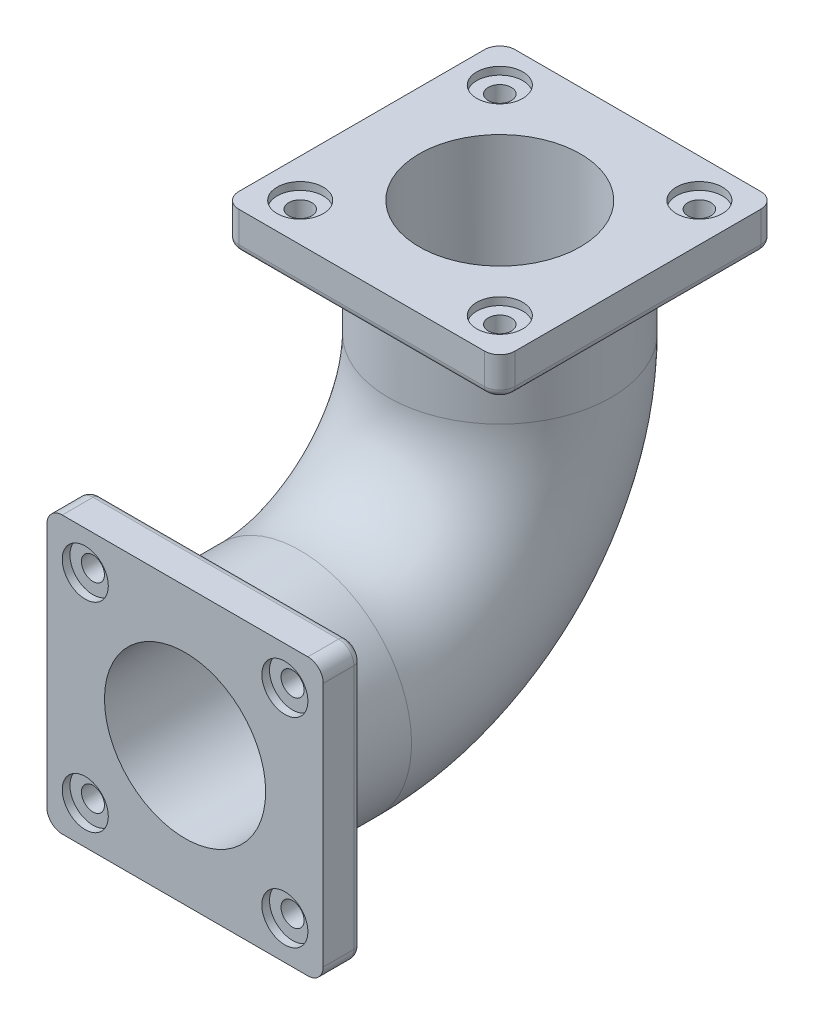
from build123d import *
from build123d.topology import SkipClean

# Parameters (mm, degrees)
IZIM3_R                     = 105
IZIM3_R_2                   = 15
Y_KSEKLIK_EKSTR_ZYON1_DEPTH = 50
IZIM4_R                     = 30
KES_EKSTR_ZYON1_DEPTH       = 10
IZIM5_R                     = 145
IZIM5_R_2                   = 105
EKSTR_ZYON_NCE1_DEPTH       = 100
IZIM95_R                    = 145
IZIM95_R_2                  = 105
RADYUS1_R                   = 10
RADYUS2_R                   = 10


with BuildPart() as part:
    # Çizim3 → Yükseklik-Ekstrüzyon1 (new body)
    with BuildSketch(Plane.XY):
        with BuildLine():
            Line((-160, -180), (160, -180))
            ThreePointArc((160, -180), (174.142135624, -174.142135624), (180, -160))
            Line((180, -160), (180, 160))
            ThreePointArc((180, 160), (174.142135624, 174.142135624), (160, 180))
            Line((160, 180), (-160, 180))
            ThreePointArc((-160, 180), (-174.142135624, 174.142135624), (-180, 160))
            Line((-180, 160), (-180, -160))
            ThreePointArc((-180, -160), (-174.142135624, -174.142135624), (-160, -180))
        make_face()
        Circle(IZIM3_R, mode=Mode.SUBTRACT)
        with Locations((-130, 130)):
            Circle(IZIM3_R_2, mode=Mode.SUBTRACT)
        with Locations((130, 130)):
            Circle(IZIM3_R_2, mode=Mode.SUBTRACT)
        with Locations((-130, -130)):
            Circle(IZIM3_R_2, mode=Mode.SUBTRACT)
        with Locations((130, -130)):
            Circle(IZIM3_R_2, mode=Mode.SUBTRACT)
    y_kseklik_ekstr_zyon1 = extrude(amount=-Y_KSEKLIK_EKSTR_ZYON1_DEPTH)

    # Çizim4 → Kes-Ekstrüzyon1 (cut)
    with BuildSketch(Plane.XY):
        with Locations((-130, 130)):
            Circle(IZIM4_R)
        with Locations((130, 130)):
            Circle(IZIM4_R)
        with Locations((130, -130)):
            Circle(IZIM4_R)
        with Locations((-130, -130)):
            Circle(IZIM4_R)
    kes_ekstr_zyon1 = extrude(amount=-KES_EKSTR_ZYON1_DEPTH, mode=Mode.SUBTRACT)

    # Çizim5 → Ekstrüzyon-İnce1 (add)
    with SkipClean():  # the faces are left unmerged after this step: merging them gives an invalid solid
        with BuildSketch(Plane(origin=(0, 0, -50), x_dir=(-1, 0, 0), z_dir=(0, 0, -1))):
            Circle(IZIM5_R)
            Circle(IZIM5_R_2, mode=Mode.SUBTRACT)
        ekstr_zyon_nce1 = extrude(amount=EKSTR_ZYON_NCE1_DEPTH)
    add(part.part.scale(1), mode=Mode.REPLACE)  # the faces are merged on a copy

    # Süpür1: sweep along a path in Çizim6
    with BuildLine(Plane(origin=(0, 0, 0), x_dir=(0, 0, -1), z_dir=(1, 0, 0))) as s_p_r1_path:
        ThreePointArc((150, 0), (333.847761128, 76.152234911), (410, 259.999994399))
    # Çizim95 → Süpür1 (sweep)
    with BuildSketch(Plane(origin=(0, 0, -150), x_dir=(-1, 0, 0), z_dir=(0, 0, -1))):
        Circle(IZIM95_R)
        Circle(IZIM95_R_2, mode=Mode.SUBTRACT)
    sweep(path=s_p_r1_path.line)

    # Aynalama1: Ekstrüzyon-İnce1 across plane
    add(ekstr_zyon_nce1.mirror(Plane(origin=(0, 204.999997199, -205.000001616), x_dir=(0, 0.7071067888032234, 0.7071067735698715), z_dir=(0, 0.7071067735698718, -0.7071067888032233))))

    # Aynalama2: Yükseklik-Ekstrüzyon1, Kes-Ekstrüzyon1 across plane
    add(y_kseklik_ekstr_zyon1.mirror(Plane(origin=(0, 204.999997199, -205.000001616), x_dir=(0, 0.7071067888032234, 0.7071067735698715), z_dir=(0, 0.7071067735698718, -0.7071067888032233))))
    add(kes_ekstr_zyon1.mirror(Plane(origin=(0, 204.999997199, -205.000001616), x_dir=(0, 0.7071067888032234, 0.7071067735698715), z_dir=(0, 0.7071067735698718, -0.7071067888032233))), mode=Mode.SUBTRACT)

    # Radyus1
    radyus1_edges = [part.edges().sort_by_distance(p)[0] for p in [
        (174.142135624, 359.999990647, -584.142137778),
        (0, 359.999990521, -590.000002154),
        (-174.142135624, 359.999990647, -584.142137778),
        (-180, 359.999994399, -410.000002154),
        (-174.142135624, 359.99999815, -235.857866531),
        (0, 359.999998277, -230.000002154),
        (174.142135624, 359.99999815, -235.857866531),
        (180, 359.999994399, -410.000002154),
    ]]
    fillet(radyus1_edges, radius=RADYUS1_R)

    # Radyus2
    radyus2_edges = [part.edges().sort_by_distance(p)[0] for p in [
        (174.142135624, -174.142135624, -50),
        (0, -180, -50),
        (-174.142135624, -174.142135624, -50),
        (-180, 0, -50),
        (-174.142135624, 174.142135624, -50),
        (0, 180, -50),
        (174.142135624, 174.142135624, -50),
        (180, 0, -50),
    ]]
    fillet(radyus2_edges, radius=RADYUS2_R)


solid = part.part
